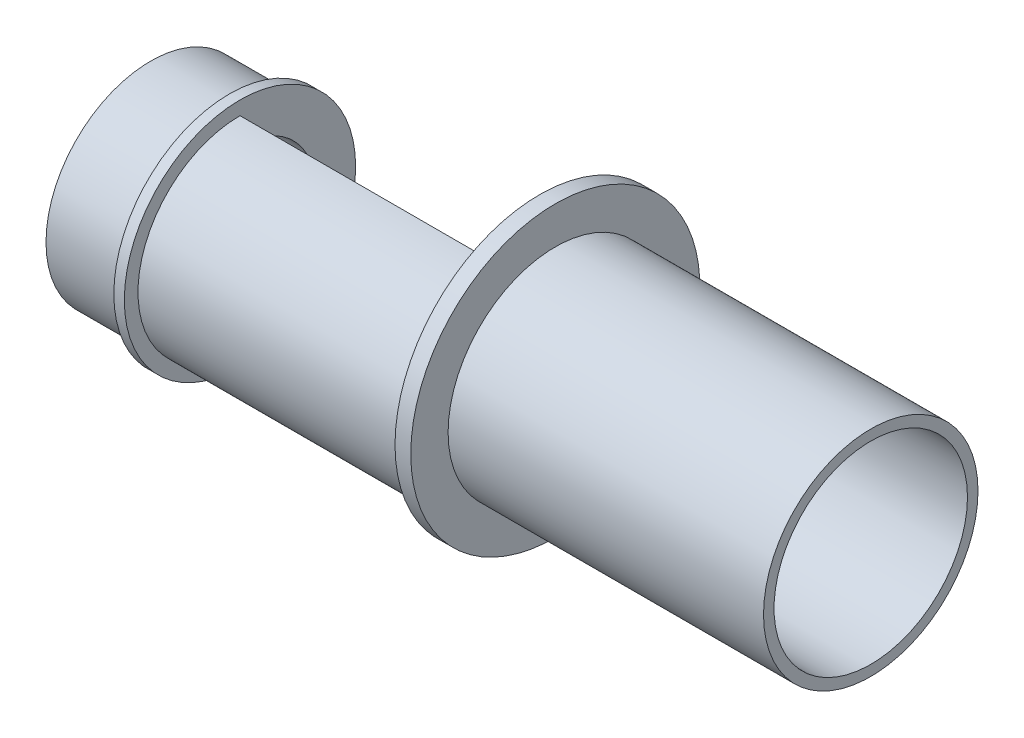
from build123d import *
from build123d.topology import SkipClean

# Parameters (mm, degrees)
CROQUIS1_R              = 20.4
CROQUIS1_R_2            = 18.4
SALIENTE_EXTRUIR1_DEPTH = 60
CROQUIS2_R              = 27.5
CROQUIS2_R_2            = 1.5
CROQUIS2_R_3            = 6.423393759
SALIENTE_EXTRUIR2_DEPTH = 3
SALIENTE_EXTRUIR5_DEPTH = 50
CROQUIS16_R             = 19.9
CROQUIS16_R_2           = 14.4
SALIENTE_EXTRUIR6_DEPTH = 17
CROQUIS17_R             = 22
CROQUIS17_R_2           = 19.9
SALIENTE_EXTRUIR7_DEPTH = 2


with BuildPart() as part:
    # Croquis1 → Saliente-Extruir1 (new body)
    with BuildSketch(Plane(origin=(0, 0, 0), x_dir=(0, 0, -1), z_dir=(1, 0, 0))):
        Circle(CROQUIS1_R)
        Circle(CROQUIS1_R_2, mode=Mode.SUBTRACT)
    extrude(amount=SALIENTE_EXTRUIR1_DEPTH)

    # Croquis2 → Saliente-Extruir2 (add)
    with BuildSketch(Plane.ZY):
        Circle(CROQUIS2_R)
        with Locations((0.897673631, 15.473984039)):
            Circle(CROQUIS2_R_2, mode=Mode.SUBTRACT)
        with Locations((-12.95202646, 8.514400189)):
            Circle(CROQUIS2_R_2, mode=Mode.SUBTRACT)
        with Locations((-13.849700092, -6.959583851)):
            Circle(CROQUIS2_R_2, mode=Mode.SUBTRACT)
        with Locations((6.988250856, -0.405400995)):
            Circle(CROQUIS2_R_3, mode=Mode.SUBTRACT)
        with BuildLine():
            ThreePointArc((9.776781646, 9.19793676), (-13.400863276, 0.777408169), (8.64759912, -10.266768209))
            ThreePointArc((8.64759912, -10.266768209), (-2.994964653, 0.173743284), (9.776781646, 9.19793676))
        make_face(mode=Mode.SUBTRACT)
    extrude(amount=SALIENTE_EXTRUIR2_DEPTH)

    # Croquis15 → Saliente-Extruir5 (add)
    with BuildSketch(Plane.ZY.offset(3)):
        with BuildLine():
            Line((6.988250856, 18.994599005), (6.988250856, 13.994599005))
            ThreePointArc((6.988250856, 13.994599005), (21.388250856, -0.405400995), (6.988250856, -14.805400995))
            Line((6.988250856, -14.805400995), (6.988250856, -19.805400995))
            ThreePointArc((6.988250856, -19.805400995), (26.388250856, -0.405400995), (6.988250856, 18.994599005))
        make_face()
    extrude(amount=SALIENTE_EXTRUIR5_DEPTH)

    # Croquis16 → Saliente-Extruir6 (add)
    with SkipClean():  # the faces are left unmerged after this step: merging them gives an invalid solid
        with BuildSketch(Plane.ZY.offset(53)):
            with Locations((6.988250856, -0.405400995)):
                Circle(CROQUIS16_R)
            with Locations((6.988250856, -0.405400995)):
                Circle(CROQUIS16_R_2, mode=Mode.SUBTRACT)
        extrude(amount=SALIENTE_EXTRUIR6_DEPTH)

    # Croquis17 → Saliente-Extruir7 (add)
    with SkipClean():  # the faces are left unmerged after this step: merging them gives an invalid solid
        with BuildSketch(Plane(origin=(-53, 0, 0), x_dir=(0, 0, -1), z_dir=(1, 0, 0))):
            with Locations((-6.988250856, -0.405400995)):
                Circle(CROQUIS17_R)
            with Locations((-6.988250856, -0.405400995)):
                Circle(CROQUIS17_R_2, mode=Mode.SUBTRACT)
        extrude(amount=-SALIENTE_EXTRUIR7_DEPTH)


solid = part.part
